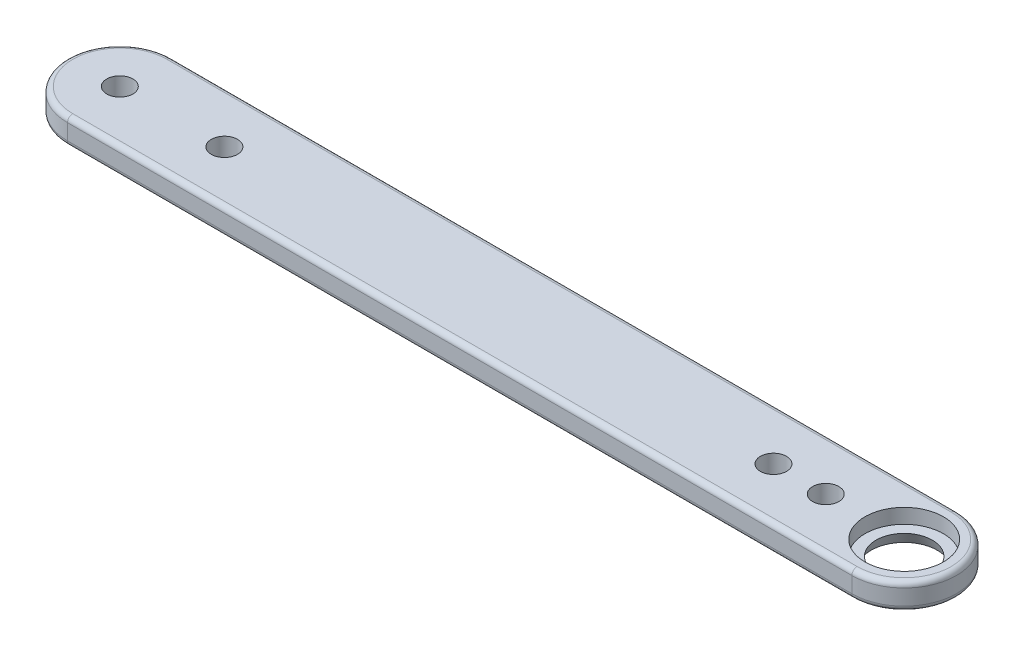
from build123d import *

# Parameters (mm, degrees)
SKETCH1_W           = 215.9
SKETCH1_H           = 25.4
BOSS_EXTRUDE1_DEPTH = 6.35
SKETCH2_R           = 3.175
SKETCH2_R_2         = 6.35
CUT_EXTRUDE1_DEPTH  = 109.879819067
SKETCH3_R           = 9.525
CUT_EXTRUDE2_DEPTH  = 3.571875
SKETCH4_R           = 3.175
CUT_EXTRUDE3_DEPTH  = 109.879819067
CUT_EXTRUDE4_DEPTH  = 109.879819067
FILLET1_R           = 1.27


with BuildPart() as part:
    # Sketch1 → Boss-Extrude1 (new body)
    with BuildSketch(Plane(origin=(0, 0, 0), x_dir=(1, 0, 0), z_dir=(0, 1, 0))):
        Rectangle(SKETCH1_W, SKETCH1_H)
    extrude(amount=BOSS_EXTRUDE1_DEPTH)

    # Sketch2 → Cut-Extrude1 (cut, through all)
    with BuildSketch(Plane(origin=(0, 6.35, 0), x_dir=(1, 0, 0), z_dir=(0, 1, 0))):
        with Locations((-95.25, 0)):
            Circle(SKETCH2_R)
        with Locations((95.25, 0)):
            Circle(SKETCH2_R_2)
        with Locations((-69.85, 0)):
            Circle(SKETCH2_R)
    extrude(amount=-CUT_EXTRUDE1_DEPTH, mode=Mode.SUBTRACT)

    # Sketch3 → Cut-Extrude2 (cut)
    with BuildSketch(Plane(origin=(0, 6.35, 0), x_dir=(1, 0, 0), z_dir=(0, 1, 0))):
        with Locations((95.25, 0)):
            Circle(SKETCH3_R)
    extrude(amount=-CUT_EXTRUDE2_DEPTH, mode=Mode.SUBTRACT)

    # Sketch4 → Cut-Extrude3 (cut, through all)
    with BuildSketch(Plane(origin=(0, 6.35, 0), x_dir=(1, 0, 0), z_dir=(0, 1, 0))):
        with Locations((76.2, 0)):
            Circle(SKETCH4_R)
        with Locations((63.5, 0)):
            Circle(SKETCH4_R)
    extrude(amount=-CUT_EXTRUDE3_DEPTH, mode=Mode.SUBTRACT)

    # Sketch5 → Cut-Extrude4 (cut, through all)
    with BuildSketch(Plane(origin=(0, 6.35, 0), x_dir=(1, 0, 0), z_dir=(0, 1, 0))):
        with BuildLine():
            Line((107.95, -12.7), (107.95, 0))
            ThreePointArc((107.95, 0), (104.230256121, -8.980256121), (95.25, -12.7))
            Line((95.25, -12.7), (107.95, -12.7))
        make_face()
        with BuildLine():
            ThreePointArc((95.25, 12.7), (104.230256121, 8.980256121), (107.95, 0))
            Line((107.95, 0), (107.95, 12.7))
            Line((107.95, 12.7), (95.25, 12.7))
        make_face()
        with BuildLine():
            ThreePointArc((-107.95, 0), (-104.230256126, 8.980256116), (-95.250000013, 12.7))
            Line((-95.250000013, 12.7), (-107.95, 12.7))
            Line((-107.95, 12.7), (-107.95, 0))
        make_face()
        with BuildLine():
            Line((-107.95, -12.7), (-95.25, -12.7))
            ThreePointArc((-95.25, -12.7), (-104.230256121, -8.980256121), (-107.95, 0))
            Line((-107.95, 0), (-107.95, -12.7))
        make_face()
    extrude(amount=-CUT_EXTRUDE4_DEPTH, mode=Mode.SUBTRACT)

    # Fillet1
    fillet1_edges = [part.edges().sort_by_distance(p)[0] for p in [
        (-7e-09, 0, -12.7),
        (-7e-09, 6.35, -12.7),
        (0, 0, 12.7),
        (0, 6.35, 12.7),
        (-107.95, 0, 7e-09),
        (-107.95, 6.35, 7e-09),
        (107.95, 0, 0),
        (107.95, 6.35, 0),
    ]]
    fillet(fillet1_edges, radius=FILLET1_R)

    # Sketch6 → Cut-Revolve2 (revolve, cut)
    with BuildSketch(Plane.ZY.offset(-95.25)):
        Polygon((-8.06821119, 0), (-6.35, 0), (-6.35, 2.778125), (-6.831310248, 2.778125), align=None)
    revolve(axis=Axis((95.25, 0, 0), (0, 1, 0)), mode=Mode.SUBTRACT)


solid = part.part
